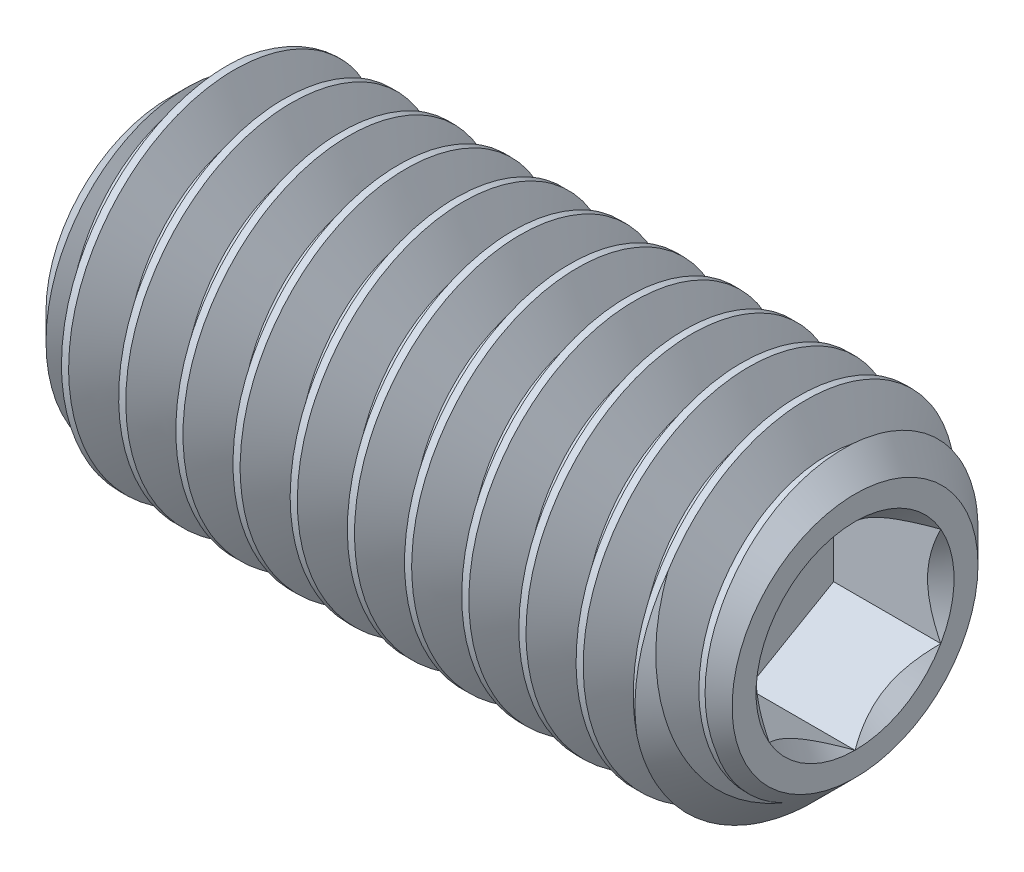
from build123d import *

# Parameters (mm, degrees)
SKETCH2_R          = 1.5
EXTRUDE1_DEPTH     = 6
CUT_SWEEP1_PITCH   = 0.5
SKETCH5_OUTSIDE_W  = 21.198
SKETCH5_OUTSIDE_H  = 21.198
SKETCH5_OUTSIDE_R  = 1.075240474
CUT_EXTRUDE1_DEPTH = 7.363961172
CUT_EXTRUDE1_DRAFT = -45
SKETCH6_OUTSIDE_W  = 21.198
SKETCH6_OUTSIDE_H  = 21.198
SKETCH6_OUTSIDE_R  = 1.075240474
CUT_EXTRUDE2_DEPTH = 7.363961172
CUT_EXTRUDE2_DRAFT = -45
CUT_EXTRUDE3_DEPTH = 0.9375


with BuildPart() as part:
    # Sketch2 → Extrude1 (new body)
    with BuildSketch(Plane(origin=(3, 0, 0), x_dir=(0, 0, -1), z_dir=(1, 0, 0))):
        Circle(SKETCH2_R)
    extrude(amount=-EXTRUDE1_DEPTH)

    # Cut-Sweep1: the profile of Sketch4 profile screwed along a right-hand helix of 18 turns, 6 arcs to a turn; built about Z, then put on its axis
    cut_sweep1_z = Axis((0, 0, 0), (0, 0, 1))
    cut_sweep1_corners = [(1.5003, 0, -0.437673205), (1.5003, 0, 0.000173205), (1.175240474, 0, -0.1875), (1.175240474, 0, -0.25)]
    with BuildLine(mode=Mode.PRIVATE) as cut_sweep1_profile:
        Line(cut_sweep1_corners[0], cut_sweep1_corners[1])
        Line(cut_sweep1_corners[1], cut_sweep1_corners[2])
        Line(cut_sweep1_corners[2], cut_sweep1_corners[3])
        Line(cut_sweep1_corners[3], cut_sweep1_corners[0])
    cut_sweep1_cap = Face(cut_sweep1_profile.wire())
    cut_sweep1_turn_angles = [0, 30, 60, 90, 120, 150, 180, 210, 240, 270, 300, 330, 360]
    cut_sweep1_turn_weights = [1, 0.8660254037844387, 1, 0.8660254037844387, 1, 0.8660254037844387, 1, 0.8660254037844387, 1, 0.8660254037844387, 1, 0.8660254037844387, 1]
    cut_sweep1_turn_rails = [Edge.make_bspline([Vector(p[0], p[1], 0).rotate(cut_sweep1_z, cut_sweep1_turn_angles[k]) / cut_sweep1_turn_weights[k] + Vector(0, 0, p[2] + CUT_SWEEP1_PITCH * cut_sweep1_turn_angles[k] / 360) for k in range(13)], [0, 0, 0, 1, 1, 2, 2, 3, 3, 4, 4, 5, 5, 6, 6, 6], 2, cut_sweep1_turn_weights) for p in cut_sweep1_corners]
    cut_sweep1_turn_sides = [Face.make_surface_from_curves(cut_sweep1_turn_rails[p[0]], cut_sweep1_turn_rails[p[1]]) for p in [(0, 1), (1, 2), (2, 3), (3, 0)]]
    cut_sweep1 = Plane(origin=(3, 0, 0), x_dir=(0, 1, 0), z_dir=(-1, 0, 0)) * Solid(Shell([*[p.moved(Location((0, 0, CUT_SWEEP1_PITCH * i))) for i in range(18) for p in cut_sweep1_turn_sides], cut_sweep1_cap, cut_sweep1_cap.rotate(cut_sweep1_z, 6480).moved(Location((0, 0, CUT_SWEEP1_PITCH * 6480 / 360)))]))
    add(cut_sweep1, mode=Mode.SUBTRACT)


with BuildPart() as cut_extrude1_tool:
    # Sketch5 outside → Cut-Extrude1 (with draft: the straight prism first)
    with BuildSketch(Plane(origin=(3, 0, 0), x_dir=(0, 0, -1), z_dir=(1, 0, 0))):
        Rectangle(SKETCH5_OUTSIDE_W, SKETCH5_OUTSIDE_H)
        Circle(SKETCH5_OUTSIDE_R, mode=Mode.SUBTRACT)
    extrude(amount=-CUT_EXTRUDE1_DEPTH)
    # Cut-Extrude1: the draft: its side faces are tilted about the plane it starts from
    cut_extrude1_sides = [cut_extrude1_tool.faces().sort_by_distance(p)[0] for p in [
        (-0.681980586, -10.599, 0),
        (-0.681980586, 0, -10.599),
        (-0.681980586, 10.599, 0),
        (-0.681980586, 0, 10.599),
        (-0.681980586, 0, 1.075240474),
    ]]
    draft(cut_extrude1_sides, Plane(origin=(3, 0, 0), x_dir=(0, 0, -1), z_dir=(1, 0, 0)), CUT_EXTRUDE1_DRAFT)


with BuildPart() as part_1:
    add(part.part)

    # Cut-Extrude1: cut by cut_extrude1_tool
    add(cut_extrude1_tool.part, mode=Mode.SUBTRACT)


with BuildPart() as cut_extrude2_tool:
    # Sketch6 outside → Cut-Extrude2 (with draft: the straight prism first)
    with BuildSketch(Plane.ZY.offset(3)):
        Rectangle(SKETCH6_OUTSIDE_W, SKETCH6_OUTSIDE_H)
        Circle(SKETCH6_OUTSIDE_R, mode=Mode.SUBTRACT)
    extrude(amount=-CUT_EXTRUDE2_DEPTH)
    # Cut-Extrude2: the draft: its side faces are tilted about the plane it starts from
    cut_extrude2_sides = [cut_extrude2_tool.faces().sort_by_distance(p)[0] for p in [
        (0.681980586, -10.599, 0),
        (0.681980586, 0, 10.599),
        (0.681980586, 10.599, 0),
        (0.681980586, 0, -10.599),
        (0.681980586, 0, -1.075240474),
    ]]
    draft(cut_extrude2_sides, Plane.ZY.offset(3), CUT_EXTRUDE2_DRAFT)


with BuildPart() as part_2:
    add(part_1.part)

    # Cut-Extrude2: cut by cut_extrude2_tool
    add(cut_extrude2_tool.part, mode=Mode.SUBTRACT)

    # Sketch8 → Cut-Extrude3 (cut)
    with BuildSketch(Plane(origin=(3, 0, 0), x_dir=(0, 0, -1), z_dir=(1, 0, 0))):
        Polygon((0, 0.866025404), (-0.75, 0.433012702), (-0.75, -0.433012702), (0, -0.866025404), (0.75, -0.433012702), (0.75, 0.433012702), align=None)
    extrude(amount=-CUT_EXTRUDE3_DEPTH, mode=Mode.SUBTRACT)

    # Cut-Extrude4 cone 1 section (through the dimple's axis) → Cut-Extrude4 (revolve, cut)
    with BuildSketch(Plane(origin=(3, 0, 0), x_dir=(0, 0, -1), z_dir=(0, 1, 0))):
        Polygon((0, 0), (0.866025404, 0), (0, 0.866025404), align=None)
    revolve(axis=Axis((3, 0, 0), (-1, 0, 0)), mode=Mode.SUBTRACT)


solid = part_2.part
